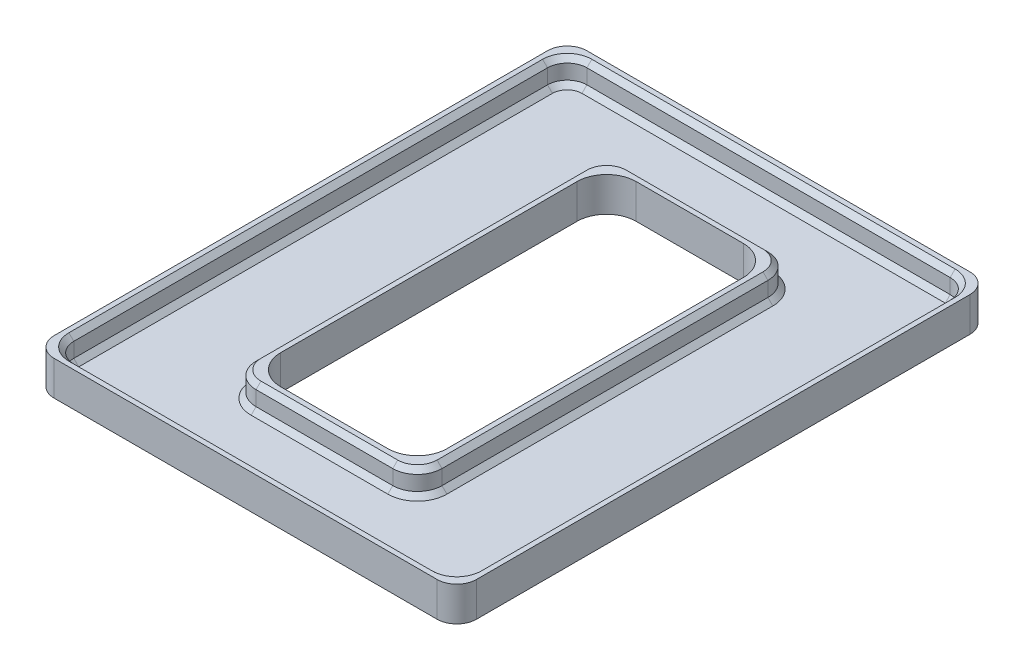
from build123d import *

# Parameters (mm, degrees)
SKETCH1_W              = 11
SKETCH1_H              = 38.09
BOSS_EXTRUDE1_DEPTH    = 3
BOSS_EXTRUDE2_DEPTH    = 3
SKETCH3_W              = 40.88
SKETCH3_H              = 46.09
CUT_EXTRUDE1_DEPTH     = 2
MOVE_START             = 3
MOVE_FACE1_OUTLINE_W   = 42.88
MOVE_FACE1_OUTLINE_H   = 48.09
MOVE_FACE1_OUTLINE_W_2 = 40.88
MOVE_FACE1_OUTLINE_H_2 = 46.09
MOVE_FACE1_DEPTH       = 0.5
MOVE_FACE2_OUTLINE_W   = 18.88
MOVE_FACE2_OUTLINE_H   = 38.09
MOVE_FACE2_OUTLINE_W_2 = 16.88
MOVE_FACE2_OUTLINE_H_2 = 36.09
MOVE_FACE2_DEPTH       = 0.5
FILLET3_R              = 3
MOVE_FACE4_BY          = 3
MOVE_FACE5_BY          = 3
MOVE_FACE6_BY          = 3
MOVE_FACE7_BY          = 3
FILLET4_R              = 2.5
FILLET5_R              = 2
CHAMFER1_SIZE          = 0.5


# Read off the part's stored shape, not the designer's step: Move Face1, Move Face2
with BuildPart() as part:
    # Sketch1 → Boss-Extrude1 (new body)
    with BuildSketch(Plane(origin=(0, 0, 0), x_dir=(1, 0, 0), z_dir=(0, 1, 0))):
        Polygon((-9.44, 19.045), (0, 19.045), (9.44, 19.045), (9.44, -19.045), (20.44, -19.045), (20.44, 23.045), (-20.44, 23.045), (-20.44, 19.045), align=None)
        with Locations((-14.94, 0)):
            Rectangle(SKETCH1_W, SKETCH1_H)
        Polygon((9.44, -19.045), (0, -19.045), (-9.44, -19.045), (-20.44, -19.045), (-20.44, -23.045), (20.44, -23.045), (20.44, -19.045), align=None)
    extrude(amount=BOSS_EXTRUDE1_DEPTH)

    # Sketch2 → Boss-Extrude2 (add)
    with BuildSketch(Plane(origin=(0, 3, 0), x_dir=(1, 0, 0), z_dir=(0, 1, 0))):
        Polygon((20.44, 23.045), (20.44, -23.045), (21.44, -23.045), (21.44, 24.045), (-21.44, 24.045), (-21.44, 23.045), (-20.44, 23.045), align=None)
        Polygon((21.44, -23.045), (20.44, -23.045), (-20.44, -23.045), (-20.44, 23.045), (-21.44, 23.045), (-21.44, -24.045), (21.44, -24.045), align=None)
        Polygon((-8.44, 19.045), (-9.44, 19.045), (-9.44, -19.045), (8.44, -19.045), (8.44, -18.045), (-8.44, -18.045), (-8.44, 18.045), align=None)
        Polygon((9.44, 19.045), (-8.44, 19.045), (-8.44, 18.045), (8.44, 18.045), (8.44, -18.045), (8.44, -19.045), (9.44, -19.045), align=None)
    extrude(amount=-BOSS_EXTRUDE2_DEPTH)

    # Sketch3 → Cut-Extrude1 (cut)
    with BuildSketch(Plane(origin=(0, 3, 0), x_dir=(1, 0, 0), z_dir=(0, 1, 0))):
        Rectangle(SKETCH3_W, SKETCH3_H)
        Polygon((9.44, 19.045), (9.44, -18.045), (9.44, -19.045), (-9.44, -19.045), (-9.44, 18.045), (-9.44, 19.045), align=None, mode=Mode.SUBTRACT)
    extrude(amount=-CUT_EXTRUDE1_DEPTH, mode=Mode.SUBTRACT)

    # Move Face1 outline → Move Face1 (add)
    with BuildSketch(Plane(origin=(0, 0, 0), x_dir=(1, 0, 0), z_dir=(0, 1, 0)).offset(MOVE_START)):
        Rectangle(MOVE_FACE1_OUTLINE_W, MOVE_FACE1_OUTLINE_H)
        Rectangle(MOVE_FACE1_OUTLINE_W_2, MOVE_FACE1_OUTLINE_H_2, mode=Mode.SUBTRACT)
    extrude(amount=MOVE_FACE1_DEPTH)

    # Move Face2 outline → Move Face2 (add)
    with BuildSketch(Plane(origin=(0, 0, 0), x_dir=(1, 0, 0), z_dir=(0, 1, 0)).offset(MOVE_START)):
        Rectangle(MOVE_FACE2_OUTLINE_W, MOVE_FACE2_OUTLINE_H)
        Rectangle(MOVE_FACE2_OUTLINE_W_2, MOVE_FACE2_OUTLINE_H_2, mode=Mode.SUBTRACT)
    extrude(amount=MOVE_FACE2_DEPTH)

    # Fillet3
    fillet3_edges = [part.edges().sort_by_distance(p)[0] for p in [
        (-8.44, 1.75, -18.045),
        (-8.44, 1.75, 18.045),
        (8.44, 1.75, 18.045),
        (8.44, 1.75, -18.045),
    ]]
    fillet(fillet3_edges, radius=FILLET3_R)

    # Move Face4: a face moved outward by 3.0
    extrude(part.faces().sort_by_distance((0, 1.75, 24.045))[0], amount=MOVE_FACE4_BY, dir=(0, 0, 1))

    # Move Face5: a face moved outward by 3.0
    extrude(part.faces().sort_by_distance((0, 1.75, -24.045))[0], amount=MOVE_FACE5_BY, dir=(0, 0, -1))

    # Move Face6: a face moved inward by 3.0
    extrude(part.faces().sort_by_distance((0, 2.25, 23.045))[0], amount=MOVE_FACE6_BY, dir=(0, 0, 1), mode=Mode.SUBTRACT)

    # Move Face7: a face moved inward by 3.0
    extrude(part.faces().sort_by_distance((0, 2.25, -23.045))[0], amount=MOVE_FACE7_BY, dir=(0, 0, -1), mode=Mode.SUBTRACT)

    # Fillet4
    fillet4_edges = [part.edges().sort_by_distance(p)[0] for p in [
        (-9.44, 2.25, 19.045),
        (9.44, 2.25, 19.045),
        (9.44, 2.25, -19.045),
        (-9.44, 2.25, -19.045),
    ]]
    fillet(fillet4_edges, radius=FILLET4_R)

    # Fillet5
    fillet5_edges = [part.edges().sort_by_distance(p)[0] for p in [
        (-21.44, 1.75, 27.045),
        (-21.44, 1.75, -27.045),
        (21.44, 1.75, -27.045),
        (21.44, 1.75, 27.045),
        (-20.44, 2.25, 26.045),
        (-20.44, 2.25, -26.045),
        (20.44, 2.25, -26.045),
        (20.44, 2.25, 26.045),
    ]]
    fillet(fillet5_edges, radius=FILLET5_R)

    # Chamfer1
    chamfer1_edges = [part.edges().sort_by_distance(p)[0] for p in [
        (0, 3.5, 19.045),
        (0, 1, 19.045),
        (9.44, 3.5, 0),
        (0, 3.5, -19.045),
        (-9.44, 3.5, 0),
        (-8.707766953, 3.5, -18.312766953),
        (8.707766953, 3.5, -18.312766953),
        (-8.707766953, 3.5, 18.312766953),
        (8.707766953, 3.5, 18.312766953),
        (9.44, 1, 0),
        (-9.44, 1, 0),
        (0, 1, -19.045),
        (8.707766953, 1, 18.312766953),
        (-8.707766953, 1, 18.312766953),
        (8.707766953, 1, -18.312766953),
        (-8.707766953, 1, -18.312766953),
        (0, 3.5, -26.045),
        (0, 1, -26.045),
        (20.44, 3.5, 0),
        (20.44, 1, 0),
        (-20.44, 1, 0),
        (0, 1, 26.045),
        (19.854213562, 1, 25.459213562),
        (-19.854213562, 1, 25.459213562),
        (-19.854213562, 1, -25.459213562),
        (19.854213562, 1, -25.459213562),
        (-20.44, 3.5, 0),
        (0, 3.5, 26.045),
        (19.854213562, 3.5, -25.459213562),
        (-19.854213562, 3.5, -25.459213562),
        (-19.854213562, 3.5, 25.459213562),
        (19.854213562, 3.5, 25.459213562),
    ]]
    chamfer(chamfer1_edges, length=CHAMFER1_SIZE)


solid = part.part
